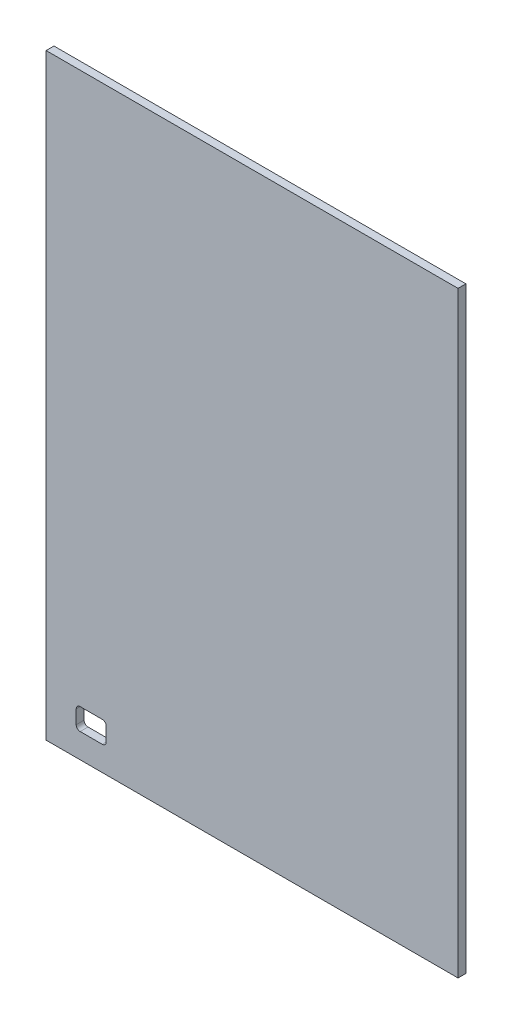
from build123d import *

# Parameters (mm, degrees)
SKETCH1_W           = 420
SKETCH1_H           = 608.95
BOSS_EXTRUDE1_DEPTH = 8


with BuildPart() as part:
    # Sketch1 → Boss-Extrude1 (new body)
    with BuildSketch(Plane.XY):
        with Locations((210, 304.475)):
            Rectangle(SKETCH1_W, SKETCH1_H)
        with BuildLine():
            Line((61.3, 43), (61.3, 29))
            ThreePointArc((61.3, 29), (61.12365555, 27.825411462), (60.610170883, 26.754389009))
            ThreePointArc((60.610170883, 26.754389009), (60.16106726, 26.204594102), (59.62184565, 25.742848978))
            ThreePointArc((59.62184565, 25.742848978), (58.518892102, 25.19023596), (57.3, 25))
            Line((57.3, 25), (34.7, 25))
            ThreePointArc((34.7, 25), (33.481107898, 25.19023596), (32.37815435, 25.742848978))
            ThreePointArc((32.37815435, 25.742848978), (31.83893274, 26.204594102), (31.389829117, 26.754389009))
            ThreePointArc((31.389829117, 26.754389009), (30.87634445, 27.825411462), (30.7, 29))
            Line((30.7, 29), (30.7, 43))
            ThreePointArc((30.7, 43), (30.87634445, 44.174588538), (31.389829117, 45.245610991))
            ThreePointArc((31.389829117, 45.245610991), (31.83893274, 45.795405898), (32.37815435, 46.257151022))
            ThreePointArc((32.37815435, 46.257151022), (33.481107898, 46.80976404), (34.7, 47))
            Line((34.7, 47), (57.3, 47))
            ThreePointArc((57.3, 47), (58.518892102, 46.80976404), (59.62184565, 46.257151022))
            ThreePointArc((59.62184565, 46.257151022), (60.16106726, 45.795405898), (60.610170883, 45.245610991))
            ThreePointArc((60.610170883, 45.245610991), (61.12365555, 44.174588538), (61.3, 43))
        make_face(mode=Mode.SUBTRACT)
    extrude(amount=BOSS_EXTRUDE1_DEPTH)


solid = part.part
